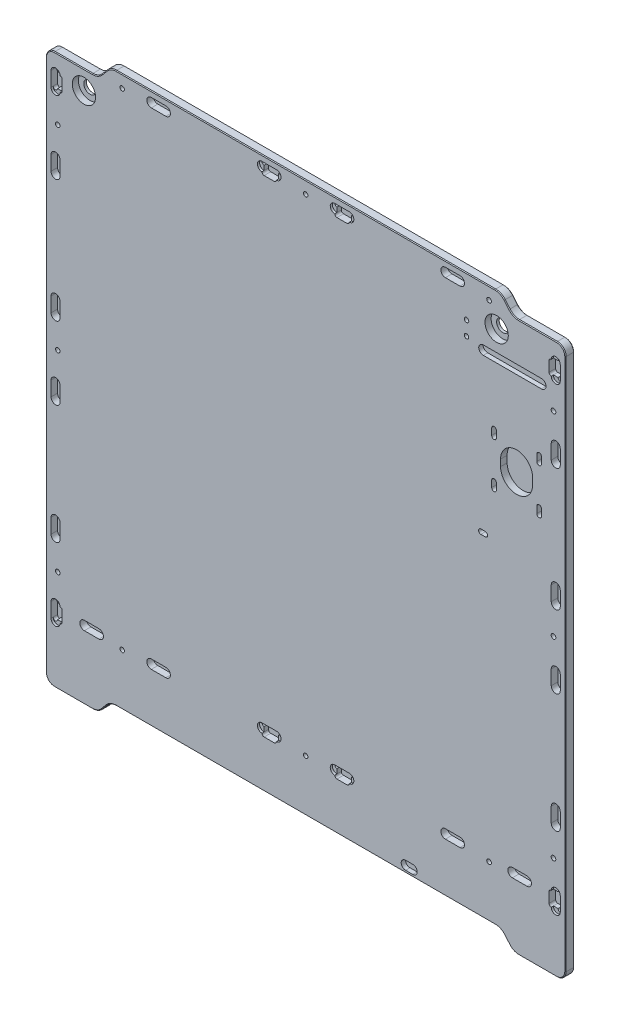
from build123d import *

# Parameters (mm, degrees)
CROQUIS1_W                                           = 357
CROQUIS1_H                                           = 388
SALIENTE_EXTRUIR1_DEPTH                              = 6
CORTAR_EXTRUIR1_DEPTH                                = 1.5
CORTAR_EXTRUIR2_DEPTH                                = 3
CORTAR_EXTRUIR3_DEPTH                                = 1.5
CORTAR_EXTRUIR4_DEPTH                                = 3
CORTAR_EXTRUIR5_DEPTH                                = 1.5
CORTAR_EXTRUIR6_DEPTH                                = 3
CORTAR_EXTRUIR7_DEPTH                                = 1.5
CORTAR_EXTRUIR8_DEPTH                                = 3
CROQUIS10_W                                          = 44.391351397
CROQUIS10_H                                          = 10.000423175
CORTAR_EXTRUIR9_DEPTH                                = 264.693477356
CROQUIS11_W                                          = 268.217297206
CROQUIS11_H                                          = 10.000423175
CORTAR_EXTRUIR10_DEPTH                               = 264.693477356
CORTAR_EXTRUIR11_DEPTH                               = 264.693477356
CORTAR_EXTRUIR12_DEPTH                               = 264.693477356
CORTAR_EXTRUIR13_DEPTH                               = 264.693477356
CORTAR_EXTRUIR14_DEPTH                               = 264.693477356
CORTAR_EXTRUIR15_DEPTH                               = 264.693477356
CORTAR_EXTRUIR16_DEPTH                               = 3
CORTAR_EXTRUIR17_DEPTH                               = 3
CORTAR_EXTRUIR18_DEPTH                               = 4.5
CORTAR_EXTRUIR19_DEPTH                               = 4.5
CORTAR_EXTRUIR20_DEPTH                               = 4.5
CORTAR_EXTRUIR21_DEPTH                               = 4.5
CORTAR_EXTRUIR22_DEPTH                               = 4.5
CORTAR_EXTRUIR23_DEPTH                               = 4.5
CORTAR_EXTRUIR24_DEPTH                               = 4.5
CORTAR_EXTRUIR25_DEPTH                               = 4.5
NGULO_DE_SALIDA1_ANGLE                               = 40
NGULO_DE_SALIDA2_ANGLE                               = 40
DI_METRO_DE_TALADRO_3_2_3_2_1_D                      = 3.2
DI_METRO_DE_TALADRO_3_1_3_1_1_D                      = 3.1
REFRENTADO_PARA_PERNO_CON_CABEZA_HEXAGON_D           = 8.5
REFRENTADO_PARA_PERNO_CON_CABEZA_HEXAGON_CBORE_D     = 16
REFRENTADO_PARA_PERNO_CON_CABEZA_HEXAGON_CBORE_DEPTH = 4.2
REDONDEO1_R                                          = 6
REDONDEO2_R                                          = 8.5
CHAFL_N1_SIZE                                        = 0.5
REDONDEO3_R                                          = 1.5


with BuildPart() as part:
    # Croquis1 → Saliente-Extruir1 (new body)
    with BuildSketch(Plane.XY.offset(3)):
        Rectangle(CROQUIS1_W, CROQUIS1_H)
    extrude(amount=-SALIENTE_EXTRUIR1_DEPTH)

    # Croquis2 → Cortar-Extruir1 (cut)
    with BuildSketch(Plane.XY.offset(3)):
        with BuildLine():
            Line((-167.2, -144.2), (-168.7, -144.2))
            ThreePointArc((-168.7, -144.2), (-171.8, -141.1), (-174.9, -144.2))
            Line((-174.9, -144.2), (-174.9, -154.2))
            ThreePointArc((-174.9, -154.2), (-171.8, -157.3), (-168.7, -154.2))
            Line((-168.7, -154.2), (-167.2, -154.2))
            Line((-167.2, -154.2), (-167.2, -144.2))
        make_face()
    cortar_extruir1 = extrude(amount=-CORTAR_EXTRUIR1_DEPTH, mode=Mode.SUBTRACT)

    # Croquis3 → Cortar-Extruir2 (cut)
    with BuildSketch(Plane.XY.offset(1.5)):
        with BuildLine():
            Line((-171.9, -154.2), (-167.2, -154.2))
            Line((-167.2, -154.2), (-167.2, -144.2))
            Line((-167.2, -144.2), (-171.9, -144.2))
            ThreePointArc((-171.9, -144.2), (-173.4, -142.7), (-174.9, -144.2))
            Line((-174.9, -144.2), (-174.9, -154.2))
            ThreePointArc((-174.9, -154.2), (-173.4, -155.7), (-171.9, -154.2))
        make_face()
    cortar_extruir2 = extrude(amount=-CORTAR_EXTRUIR2_DEPTH, mode=Mode.SUBTRACT)

    # Croquis4 → Cortar-Extruir3 (cut)
    with BuildSketch(Plane.XY.offset(3)):
        with BuildLine():
            Line((-20, 182.4), (-20, 183.9))
            ThreePointArc((-20, 183.9), (-16.9, 187), (-20, 190.1))
            Line((-20, 190.1), (-30, 190.1))
            ThreePointArc((-30, 190.1), (-33.1, 187), (-30, 183.9))
            Line((-30, 183.9), (-30, 182.4))
            Line((-30, 182.4), (-20, 182.4))
        make_face()
    cortar_extruir3 = extrude(amount=-CORTAR_EXTRUIR3_DEPTH, mode=Mode.SUBTRACT)

    # Croquis5 → Cortar-Extruir4 (cut)
    with BuildSketch(Plane.XY.offset(1.5)):
        with BuildLine():
            Line((-20, 190.1), (-30, 190.1))
            ThreePointArc((-30, 190.1), (-31.5, 188.6), (-30, 187.1))
            Line((-30, 187.1), (-30, 182.4))
            Line((-30, 182.4), (-20, 182.4))
            Line((-20, 182.4), (-20, 187.1))
            ThreePointArc((-20, 187.1), (-18.5, 188.6), (-20, 190.1))
        make_face()
    cortar_extruir4 = extrude(amount=-CORTAR_EXTRUIR4_DEPTH, mode=Mode.SUBTRACT)

    # Croquis6 → Cortar-Extruir5 (cut)
    with BuildSketch(Plane.XY.offset(3)):
        with BuildLine():
            Line((-167.2, 171.7), (-168.7, 171.7))
            ThreePointArc((-168.7, 171.7), (-171.8, 174.8), (-174.9, 171.7))
            Line((-174.9, 171.7), (-174.9, 161.7))
            ThreePointArc((-174.9, 161.7), (-171.8, 158.6), (-168.7, 161.7))
            Line((-168.7, 161.7), (-167.2, 161.7))
            Line((-167.2, 161.7), (-167.2, 171.7))
        make_face()
    cortar_extruir5 = extrude(amount=-CORTAR_EXTRUIR5_DEPTH, mode=Mode.SUBTRACT)

    # Croquis7 → Cortar-Extruir6 (cut)
    with BuildSketch(Plane.XY.offset(1.5)):
        with BuildLine():
            Line((-171.9, 161.7), (-167.2, 161.7))
            Line((-167.2, 161.7), (-167.2, 171.7))
            Line((-167.2, 171.7), (-171.9, 171.7))
            ThreePointArc((-171.9, 171.7), (-173.4, 173.2), (-174.9, 171.7))
            Line((-174.9, 171.7), (-174.9, 161.7))
            ThreePointArc((-174.9, 161.7), (-173.4, 160.2), (-171.9, 161.7))
        make_face()
    cortar_extruir6 = extrude(amount=-CORTAR_EXTRUIR6_DEPTH, mode=Mode.SUBTRACT)

    # Croquis8 → Cortar-Extruir7 (cut)
    with BuildSketch(Plane.XY.offset(3)):
        with BuildLine():
            Line((-20, -151.6), (-20, -150.1))
            ThreePointArc((-20, -150.1), (-16.9, -147), (-20, -143.9))
            Line((-20, -143.9), (-30, -143.9))
            ThreePointArc((-30, -143.9), (-33.1, -147), (-30, -150.1))
            Line((-30, -150.1), (-30, -151.6))
            Line((-30, -151.6), (-20, -151.6))
        make_face()
    cortar_extruir7 = extrude(amount=-CORTAR_EXTRUIR7_DEPTH, mode=Mode.SUBTRACT)

    # Croquis9 → Cortar-Extruir8 (cut)
    with BuildSketch(Plane.XY.offset(1.5)):
        with BuildLine():
            Line((-30, -146.9), (-30, -151.6))
            Line((-30, -151.6), (-20, -151.6))
            Line((-20, -151.6), (-20, -146.9))
            ThreePointArc((-20, -146.9), (-18.5, -145.4), (-20, -143.9))
            Line((-20, -143.9), (-30, -143.9))
            ThreePointArc((-30, -143.9), (-31.5, -145.4), (-30, -146.9))
        make_face()
    cortar_extruir8 = extrude(amount=-CORTAR_EXTRUIR8_DEPTH, mode=Mode.SUBTRACT)

    # Croquis10 → Cortar-Extruir9 (cut, through all)
    with BuildSketch(Plane(origin=(0, 0, -3), x_dir=(-1, 0, 0), z_dir=(0, 0, -1))):
        with Locations((156.304324302, 188.999788413)):
            Rectangle(CROQUIS10_W, CROQUIS10_H)
    cortar_extruir9 = extrude(amount=-CORTAR_EXTRUIR9_DEPTH, mode=Mode.SUBTRACT)

    # Croquis11 → Cortar-Extruir10 (cut, through all)
    with BuildSketch(Plane(origin=(0, 0, -3), x_dir=(-1, 0, 0), z_dir=(0, 0, -1))):
        with Locations((0, -188.999788413)):
            Rectangle(CROQUIS11_W, CROQUIS11_H)
    extrude(amount=-CORTAR_EXTRUIR10_DEPTH, mode=Mode.SUBTRACT)

    # Croquis12 → Cortar-Extruir11 (cut, through all)
    with BuildSketch(Plane.XY.offset(3)):
        with BuildLine():
            Line((162, 74.95), (162, 79.45))
            ThreePointArc((162, 79.45), (160.4, 81.05), (158.8, 79.45))
            Line((158.8, 79.45), (158.8, 74.95))
            ThreePointArc((158.8, 74.95), (160.4, 73.35), (162, 74.95))
        make_face()
    extrude(amount=-CORTAR_EXTRUIR11_DEPTH, mode=Mode.SUBTRACT)

    # Croquis13 → Cortar-Extruir12 (cut, through all)
    with BuildSketch(Plane.XY.offset(3)):
        with BuildLine():
            Line((158.8, 110.45), (158.8, 105.95))
            ThreePointArc((158.8, 105.95), (160.4, 104.35), (162, 105.95))
            Line((162, 105.95), (162, 110.45))
            ThreePointArc((162, 110.45), (160.4, 112.05), (158.8, 110.45))
        make_face()
    extrude(amount=-CORTAR_EXTRUIR12_DEPTH, mode=Mode.SUBTRACT)

    # Croquis14 → Cortar-Extruir13 (cut, through all)
    with BuildSketch(Plane.XY.offset(3)):
        with BuildLine():
            Line((127.8, 79.45), (127.8, 74.95))
            ThreePointArc((127.8, 74.95), (129.4, 73.35), (131, 74.95))
            Line((131, 74.95), (131, 79.45))
            ThreePointArc((131, 79.45), (129.4, 81.05), (127.8, 79.45))
        make_face()
    extrude(amount=-CORTAR_EXTRUIR13_DEPTH, mode=Mode.SUBTRACT)

    # Croquis15 → Cortar-Extruir14 (cut, through all)
    with BuildSketch(Plane.XY.offset(3)):
        with BuildLine():
            Line((127.8, 110.45), (127.8, 105.95))
            ThreePointArc((127.8, 105.95), (129.4, 104.35), (131, 105.95))
            Line((131, 105.95), (131, 110.45))
            ThreePointArc((131, 110.45), (129.4, 112.05), (127.8, 110.45))
        make_face()
    extrude(amount=-CORTAR_EXTRUIR14_DEPTH, mode=Mode.SUBTRACT)

    # Croquis16 → Cortar-Extruir15 (cut, through all)
    with BuildSketch(Plane(origin=(0, 0, -3), x_dir=(-1, 0, 0), z_dir=(0, 0, -1))):
        with BuildLine():
            Line((-123.4, 43.4), (-120.4, 43.4))
            ThreePointArc((-120.4, 43.4), (-118.8, 45), (-120.4, 46.6))
            Line((-120.4, 46.6), (-123.4, 46.6))
            ThreePointArc((-123.4, 46.6), (-125, 45), (-123.4, 43.4))
        make_face()
    extrude(amount=-CORTAR_EXTRUIR15_DEPTH, mode=Mode.SUBTRACT)

    # Croquis17 → Cortar-Extruir16 (cut)
    with BuildSketch(Plane.XY.offset(3)):
        with BuildLine():
            Line((73.65, -176.3), (68.65, -176.3))
            ThreePointArc((68.65, -176.3), (65.65, -179.3), (68.65, -182.3))
            Line((68.65, -182.3), (73.65, -182.3))
            ThreePointArc((73.65, -182.3), (76.65, -179.3), (73.65, -176.3))
        make_face()
    extrude(amount=-CORTAR_EXTRUIR16_DEPTH, mode=Mode.SUBTRACT)

    # Croquis18 → Cortar-Extruir17 (cut)
    with BuildSketch(Plane.XY.offset(3)):
        with BuildLine():
            Line((122, 150.723738542), (162, 150.723738542))
            ThreePointArc((162, 150.723738542), (165.1, 153.823738542), (162, 156.923738542))
            Line((162, 156.923738542), (122, 156.923738542))
            ThreePointArc((122, 156.923738542), (118.9, 153.823738542), (122, 150.723738542))
        make_face()
    extrude(amount=-CORTAR_EXTRUIR17_DEPTH, mode=Mode.SUBTRACT)

    # Croquis19 → Cortar-Extruir18 (cut)
    with BuildSketch(Plane.XY.offset(3)):
        with BuildLine():
            Line((-152, -150.1), (-142, -150.1))
            ThreePointArc((-142, -150.1), (-138.9, -147), (-142, -143.9))
            Line((-142, -143.9), (-152, -143.9))
            ThreePointArc((-152, -143.9), (-155.1, -147), (-152, -150.1))
        make_face()
    cortar_extruir18 = extrude(amount=-CORTAR_EXTRUIR18_DEPTH, mode=Mode.SUBTRACT)

    # Croquis20 → Cortar-Extruir19 (cut)
    with BuildSketch(Plane.XY.offset(3)):
        with BuildLine():
            Line((-106, -150.1), (-96, -150.1))
            ThreePointArc((-96, -150.1), (-92.9, -147), (-96, -143.9))
            Line((-96, -143.9), (-106, -143.9))
            ThreePointArc((-106, -143.9), (-109.1, -147), (-106, -150.1))
        make_face()
    cortar_extruir19 = extrude(amount=-CORTAR_EXTRUIR19_DEPTH, mode=Mode.SUBTRACT)

    # Croquis21 → Cortar-Extruir20 (cut)
    with BuildSketch(Plane.XY.offset(3)):
        with BuildLine():
            Line((-168.7, -104.2), (-168.7, -94.2))
            ThreePointArc((-168.7, -94.2), (-171.8, -91.1), (-174.9, -94.2))
            Line((-174.9, -94.2), (-174.9, -104.2))
            ThreePointArc((-174.9, -104.2), (-171.8, -107.3), (-168.7, -104.2))
        make_face()
    cortar_extruir20 = extrude(amount=-CORTAR_EXTRUIR20_DEPTH, mode=Mode.SUBTRACT)

    # Croquis22 → Cortar-Extruir21 (cut)
    with BuildSketch(Plane.XY.offset(3)):
        with BuildLine():
            Line((-168.7, -22.5), (-168.7, -12.5))
            ThreePointArc((-168.7, -12.5), (-171.8, -9.4), (-174.9, -12.5))
            Line((-174.9, -12.5), (-174.9, -22.5))
            ThreePointArc((-174.9, -22.5), (-171.8, -25.6), (-168.7, -22.5))
        make_face()
    cortar_extruir21 = extrude(amount=-CORTAR_EXTRUIR21_DEPTH, mode=Mode.SUBTRACT)

    # Croquis23 → Cortar-Extruir22 (cut)
    with BuildSketch(Plane.XY.offset(3)):
        with BuildLine():
            Line((-168.7, 27.5), (-168.7, 37.5))
            ThreePointArc((-168.7, 37.5), (-171.8, 40.6), (-174.9, 37.5))
            Line((-174.9, 37.5), (-174.9, 27.5))
            ThreePointArc((-174.9, 27.5), (-171.8, 24.4), (-168.7, 27.5))
        make_face()
    cortar_extruir22 = extrude(amount=-CORTAR_EXTRUIR22_DEPTH, mode=Mode.SUBTRACT)

    # Croquis24 → Cortar-Extruir23 (cut)
    with BuildSketch(Plane.XY.offset(3)):
        with BuildLine():
            Line((-168.7, 111.7), (-168.7, 121.7))
            ThreePointArc((-168.7, 121.7), (-171.8, 124.8), (-174.9, 121.7))
            Line((-174.9, 121.7), (-174.9, 111.7))
            ThreePointArc((-174.9, 111.7), (-171.8, 108.6), (-168.7, 111.7))
        make_face()
    cortar_extruir23 = extrude(amount=-CORTAR_EXTRUIR23_DEPTH, mode=Mode.SUBTRACT)

    # Croquis25 → Cortar-Extruir24 (cut)
    with BuildSketch(Plane.XY.offset(3)):
        with BuildLine():
            Line((-106, 183.9), (-96, 183.9))
            ThreePointArc((-96, 183.9), (-92.9, 187), (-96, 190.1))
            Line((-96, 190.1), (-106, 190.1))
            ThreePointArc((-106, 190.1), (-109.1, 187), (-106, 183.9))
        make_face()
    cortar_extruir24 = extrude(amount=-CORTAR_EXTRUIR24_DEPTH, mode=Mode.SUBTRACT)

    # Simetría1: Cortar-Extruir1, Cortar-Extruir2, Cortar-Extruir3, Cortar-Extruir4, Cortar-Extruir5, Cortar-Extruir6, Cortar-Extruir7, Cortar-Extruir8, Cortar-Extruir9, Cortar-Extruir18, Cortar-Extruir19, Cortar-Extruir20, Cortar-Extruir21, Cortar-Extruir22, Cortar-Extruir23, Cortar-Extruir24 across plane
    add(cortar_extruir1.mirror(Plane(origin=(0, 0, 0), x_dir=(0, 0, 1), z_dir=(1, 0, 0))), mode=Mode.SUBTRACT)
    add(cortar_extruir2.mirror(Plane(origin=(0, 0, 0), x_dir=(0, 0, 1), z_dir=(1, 0, 0))), mode=Mode.SUBTRACT)
    add(cortar_extruir3.mirror(Plane(origin=(0, 0, 0), x_dir=(0, 0, 1), z_dir=(1, 0, 0))), mode=Mode.SUBTRACT)
    add(cortar_extruir4.mirror(Plane(origin=(0, 0, 0), x_dir=(0, 0, 1), z_dir=(1, 0, 0))), mode=Mode.SUBTRACT)
    add(cortar_extruir5.mirror(Plane(origin=(0, 0, 0), x_dir=(0, 0, 1), z_dir=(1, 0, 0))), mode=Mode.SUBTRACT)
    add(cortar_extruir6.mirror(Plane(origin=(0, 0, 0), x_dir=(0, 0, 1), z_dir=(1, 0, 0))), mode=Mode.SUBTRACT)
    add(cortar_extruir7.mirror(Plane(origin=(0, 0, 0), x_dir=(0, 0, 1), z_dir=(1, 0, 0))), mode=Mode.SUBTRACT)
    add(cortar_extruir8.mirror(Plane(origin=(0, 0, 0), x_dir=(0, 0, 1), z_dir=(1, 0, 0))), mode=Mode.SUBTRACT)
    add(cortar_extruir9.mirror(Plane(origin=(0, 0, 0), x_dir=(0, 0, 1), z_dir=(1, 0, 0))), mode=Mode.SUBTRACT)
    add(cortar_extruir18.mirror(Plane(origin=(0, 0, 0), x_dir=(0, 0, 1), z_dir=(1, 0, 0))), mode=Mode.SUBTRACT)
    add(cortar_extruir19.mirror(Plane(origin=(0, 0, 0), x_dir=(0, 0, 1), z_dir=(1, 0, 0))), mode=Mode.SUBTRACT)
    add(cortar_extruir20.mirror(Plane(origin=(0, 0, 0), x_dir=(0, 0, 1), z_dir=(1, 0, 0))), mode=Mode.SUBTRACT)
    add(cortar_extruir21.mirror(Plane(origin=(0, 0, 0), x_dir=(0, 0, 1), z_dir=(1, 0, 0))), mode=Mode.SUBTRACT)
    add(cortar_extruir22.mirror(Plane(origin=(0, 0, 0), x_dir=(0, 0, 1), z_dir=(1, 0, 0))), mode=Mode.SUBTRACT)
    add(cortar_extruir23.mirror(Plane(origin=(0, 0, 0), x_dir=(0, 0, 1), z_dir=(1, 0, 0))), mode=Mode.SUBTRACT)
    add(cortar_extruir24.mirror(Plane(origin=(0, 0, 0), x_dir=(0, 0, 1), z_dir=(1, 0, 0))), mode=Mode.SUBTRACT)

    # Croquis27 → Cortar-Extruir25 (cut)
    with BuildSketch(Plane.XY.offset(3)):
        with BuildLine():
            Line((155.9, 90.45), (155.9, 94.95))
            ThreePointArc((155.9, 94.95), (144.9, 105.95), (133.9, 94.95))
            Line((133.9, 94.95), (133.9, 90.45))
            ThreePointArc((133.9, 90.45), (144.9, 79.45), (155.9, 90.45))
        make_face()
    extrude(amount=-CORTAR_EXTRUIR25_DEPTH, mode=Mode.SUBTRACT)

    # Ángulo de salida1
    ngulo_de_salida1_faces = [part.faces().sort_by_distance(p)[0] for p in [
        (-134.108648603, -188.999788413, 0),
        (134.108648603, -188.999788413, 0),
    ]]
    draft(ngulo_de_salida1_faces, Plane(origin=(-134.108648603, -183.999576825, 3.000025), x_dir=(0, 0, -1), z_dir=(0, -1, 0)), NGULO_DE_SALIDA1_ANGLE)

    # Ángulo de salida2
    ngulo_de_salida2_faces = [part.faces().sort_by_distance(p)[0] for p in [
        (-134.108648603, 188.999788413, 0),
        (134.108648603, 188.999788413, 0),
    ]]
    draft(ngulo_de_salida2_faces, Plane(origin=(178.5, 194, -3), x_dir=(1, 0, 0), z_dir=(0, 1, 0)), NGULO_DE_SALIDA2_ANGLE)

    # Diámetro de taladro Ø3.2 (3.2)1 (through all)
    with Locations(Plane.XY.offset(3)):
        with Locations((170.25, -124.3), (170.25, 7.6), (170.25, 141.7), (126, 185.45), (126, -148.55)):
            Hole(DI_METRO_DE_TALADRO_3_2_3_2_1_D / 2)

    # Diámetro de taladro Ø3.1 (3.1)1 (through all)
    with Locations(Plane(origin=(0, 0, -3), x_dir=(-1, 0, 0), z_dir=(0, 0, -1))):
        with Locations((-110.5, 156.3), (-110.5, 166), (0, 185.45), (0, -148.55), (170.25, -124.3), (170.25, 7.6), (170.25, 141.7), (126, 185.45), (126, -148.55)):
            Hole(DI_METRO_DE_TALADRO_3_1_3_1_1_D / 2)

    # Refrentado para perno con cabeza hexagonal de M81 (through all)
    with Locations(Plane.XY.offset(3)):
        with Locations((-152.3, 171), (131.2, 171)):
            CounterBoreHole(REFRENTADO_PARA_PERNO_CON_CABEZA_HEXAGON_D / 2, REFRENTADO_PARA_PERNO_CON_CABEZA_HEXAGON_CBORE_D / 2, REFRENTADO_PARA_PERNO_CON_CABEZA_HEXAGON_CBORE_DEPTH)

    # Redondeo1
    redondeo1_edges = [part.edges().sort_by_distance(p)[0] for p in [
        (-178.5, 183.999576825, 0),
        (178.5, 183.999576825, 0),
        (-178.5, -194, 0),
        (178.5, -194, 0),
    ]]
    fillet(redondeo1_edges, radius=REDONDEO1_R)

    # Redondeo2
    redondeo2_edges = [part.edges().sort_by_distance(p)[0] for p in [
        (-134.108648603, 194, 0),
        (-142.5, 183.999576825, 0),
        (-142.5, -194, 0),
        (142.5, -194, 0),
        (134.108648603, -183.999576825, 0),
        (-134.108648603, -183.999576825, 0),
        (134.108648603, 194, 0),
        (142.5, 183.999576825, 0),
    ]]
    fillet(redondeo2_edges, radius=REDONDEO2_R)

    # Chaflán1
    chafl_n1_edges = [part.edges().sort_by_distance(p)[0] for p in [
        (159.481807547, 183.999576825, 3),
        (-159.481807547, 183.999576825, 3),
        (-178.5, -5.000211587, 3),
        (-159.481807547, -194, 3),
        (178.5, -5.000211587, 3),
        (-176.742640687, 182.242217513, 3),
        (-176.742640687, -192.242640687, 3),
        (176.742640687, 182.242217513, 3),
        (176.742640687, -192.242640687, 3),
        (178.5, -5.000211587, -3),
        (-159.481807547, -194, -3),
        (-178.5, -5.000211587, -3),
        (-176.742640687, 182.242217513, -3),
        (-176.742640687, -192.242640687, -3),
        (176.742640687, 182.242217513, -3),
        (176.742640687, -192.242640687, -3),
        (-138.304324301, -188.999788413, 3),
        (-138.304324301, -188.999788413, -3),
        (159.481807547, -194, -3),
        (138.304324301, -188.999788413, -3),
        (0, -183.999576825, -3),
        (-159.481807547, 183.999576825, -3),
        (-138.304324301, 188.999788413, -3),
        (0, 194, -3),
        (138.304324301, 188.999788413, -3),
        (159.481807547, 183.999576825, -3),
        (-133.737288733, 193.20361619, -3),
        (133.737288733, 193.20361619, -3),
        (142.87135987, -193.20361619, -3),
        (-142.87135987, -193.20361619, -3),
        (159.481807547, -194, 3),
        (138.304324301, 188.999788413, 3),
        (0, 194, 3),
        (-138.304324301, 188.999788413, 3),
        (0, -183.999576825, 3),
        (138.304324301, -188.999788413, 3),
        (-133.737288733, 193.20361619, 3),
        (133.737288733, 193.20361619, 3),
        (142.87135987, -193.20361619, 3),
        (-142.87135987, -193.20361619, 3),
        (133.737288733, -184.795960636, -3),
        (133.737288733, -184.795960636, 3),
        (-142.87135987, 184.795960636, -3),
        (-142.87135987, 184.795960636, 3),
        (-133.737288733, -184.795960636, -3),
        (-133.737288733, -184.795960636, 3),
        (142.87135987, 184.795960636, -3),
        (142.87135987, 184.795960636, 3),
    ]]
    chamfer(chafl_n1_edges, length=CHAFL_N1_SIZE)

    # Redondeo3
    redondeo3_edges = [part.edges().sort_by_distance(p)[0] for p in [
        (-30, -151.6, 0.75),
        (-167.2, -154.2, 0.75),
        (20, 182.4, 0.75),
        (-20, -151.6, 0.75),
        (-167.2, 161.7, 0.75),
        (-20, 182.4, 0.75),
        (30, -151.6, 0.75),
        (167.2, -144.2, 0.75),
        (30, 182.4, 0.75),
        (167.2, -154.2, 0.75),
        (-167.2, -144.2, 0.75),
        (167.2, 171.7, 0.75),
        (-167.2, 171.7, 0.75),
        (167.2, 161.7, 0.75),
        (20, -151.6, 0.75),
        (-30, 182.4, 0.75),
    ]]
    fillet(redondeo3_edges, radius=REDONDEO3_R - 0.0001)  # a hair under: the kernel refuses the full size


solid = part.part
